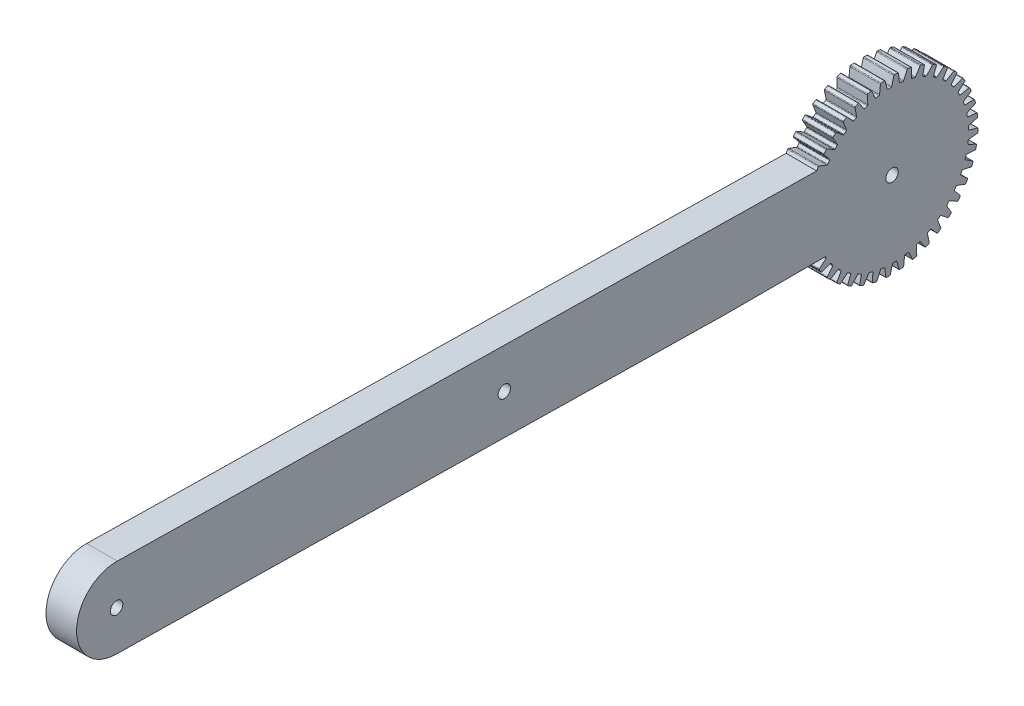
from build123d import *

# Parameters (mm, degrees)
SKETCH2_R           = 1.625
BOSS_EXTRUDE1_DEPTH = 8
CUT_EXTRUDE1_DEPTH  = 279.604808249


with BuildPart() as part:
    # Sketch2 → Boss-Extrude1 (new body)
    with BuildSketch(Plane(origin=(0, 0, 0), x_dir=(0, 0, -1), z_dir=(1, 0, 0))):
        with BuildLine():
            Line((-43.23933315, 11.215547635), (-202.79379149, 13.913019855))
            ThreePointArc((-202.79379149, 13.913019855), (-213.452530796, 3.608688081), (-203.148199023, -7.050051225))
            Line((-203.148199023, -7.050051225), (-43.593740683, -9.747523445))
            ThreePointArc((-43.593740683, -9.747523445), (44.663836211, -0.755099285), (-43.23933315, 11.215547635))
        make_face()
        Circle(SKETCH2_R, mode=Mode.SUBTRACT)
        with Locations((-101.485497628, 1.715742158)):
            Circle(SKETCH2_R, mode=Mode.SUBTRACT)
        with Locations((-202.970995256, 3.431484315)):
            Circle(SKETCH2_R, mode=Mode.SUBTRACT)
    extrude(amount=BOSS_EXTRUDE1_DEPTH)

    # Sketch3 → Cut-Extrude1 (cut, through all)
    with BuildSketch(Plane(origin=(42.059935628, -65.895972954, -38.789342463), x_dir=(0, 0, -1), z_dir=(1, 0, 0))):
        with BuildLine():
            Line((-102.949192545, 77.465208689), (-58.517985993, 76.714042306))
            ThreePointArc((-58.517985993, 76.714042306), (-58.31883232, 77.069559037), (-58.113272808, 77.421410735))
            add(Edge.make_bspline(
                [(-57.869092819, 77.506556913), (-57.913153745, 77.523470318), (-57.962778173, 77.523903324), (-58.050621186, 77.493152516), (-58.089100649, 77.461938576), (-58.113272808, 77.421410735)],
                knots=[0, 0, 0, 0, 0.5, 0.5, 1, 1, 1, 1], degree=3))
            Line((-57.869092819, 77.506556913), (-55.827954437, 76.723037297))
            add(Edge.make_bspline(
                [(-55.827954437, 76.723037297), (-55.684412293, 76.66793663), (-55.593547591, 76.793001162)],
                knots=[0.26035441, 0.26035441, 0.26035441, 1.570796327, 1.570796327, 1.570796327], degree=2, weights=[1, 0.79291331, 1]))
            Line((-55.593547591, 76.793001162), (-55.158102479, 77.392339943))
            add(Edge.make_bspline(
                [(-55.158102479, 77.392339943), (-55.067237778, 77.517404475), (-55.163998588, 77.636894124)],
                knots=[1.570796327, 1.570796327, 1.570796327, 2.881238244, 2.881238244, 2.881238244], degree=2, weights=[1, 0.79291331, 1]))
            Line((-55.163998588, 77.636894124), (-56.593034605, 79.401606638))
            add(Edge.make_bspline(
                [(-56.595360501, 79.650816525), (-56.623008193, 79.615025838), (-56.637870062, 79.570981421), (-56.637143942, 79.480671547), (-56.621500493, 79.436759083), (-56.593034605, 79.401606638)],
                knots=[0, 0, 0, 0, 0.5, 0.5, 1, 1, 1, 1], degree=3))
            ThreePointArc((-56.595360501, 79.650816525), (-56.336898995, 79.979057125), (-56.072387465, 80.302442177))
            add(Edge.make_bspline(
                [(-55.817893941, 80.348341897), (-55.85876649, 80.371939675), (-55.907712222, 80.380130228), (-55.999283134, 80.363500184), (-56.04217301, 80.338689629), (-56.072387465, 80.302442177)],
                knots=[0, 0, 0, 0, 0.5, 0.5, 1, 1, 1, 1], degree=3))
            Line((-55.817893941, 80.348341897), (-53.924454831, 79.255164318))
            add(Edge.make_bspline(
                [(-53.924454831, 79.255164318), (-53.791299572, 79.178287093), (-53.681989163, 79.287597502)],
                knots=[0.26035441, 0.26035441, 0.26035441, 1.570796327, 1.570796327, 1.570796327], degree=2, weights=[1, 0.79291331, 1]))
            Line((-53.681989163, 79.287597502), (-53.158147861, 79.811438804))
            add(Edge.make_bspline(
                [(-53.158147861, 79.811438804), (-53.048837452, 79.920749213), (-53.125714676, 80.053904472)],
                knots=[1.570796327, 1.570796327, 1.570796327, 2.881238244, 2.881238244, 2.881238244], degree=2, weights=[1, 0.79291331, 1]))
            Line((-53.125714676, 80.053904472), (-54.261095031, 82.020440932))
            add(Edge.make_bspline(
                [(-54.224407276, 82.266946482), (-54.257313476, 82.235921489), (-54.278882435, 82.194744241), (-54.292292832, 82.105432641), (-54.283711403, 82.059613638), (-54.261095031, 82.020440932)],
                knots=[0, 0, 0, 0, 0.5, 0.5, 1, 1, 1, 1], degree=3))
            ThreePointArc((-54.224407276, 82.266946482), (-53.917779718, 82.550713608), (-53.605936196, 82.828738534))
            add(Edge.make_bspline(
                [(-53.347395611, 82.834261594), (-53.384073377, 82.863962664), (-53.431135203, 82.87970908), (-53.524179072, 82.877608962), (-53.570423444, 82.85981308), (-53.605936196, 82.828738534)],
                knots=[0, 0, 0, 0, 0.5, 0.5, 1, 1, 1, 1], degree=3))
            Line((-53.347395611, 82.834261594), (-51.648278528, 81.45834371))
            add(Edge.make_bspline(
                [(-51.648278528, 81.45834371), (-51.528788879, 81.3615829), (-51.403724347, 81.452447601)],
                knots=[0.26035441, 0.26035441, 0.26035441, 1.570796327, 1.570796327, 1.570796327], degree=2, weights=[1, 0.79291331, 1]))
            Line((-51.403724347, 81.452447601), (-50.804385567, 81.887892714))
            add(Edge.make_bspline(
                [(-50.804385567, 81.887892714), (-50.679321035, 81.978757415), (-50.734421702, 82.122299559)],
                knots=[1.570796327, 1.570796327, 1.570796327, 2.881238244, 2.881238244, 2.881238244], degree=2, weights=[1, 0.79291331, 1]))
            Line((-50.734421702, 82.122299559), (-51.548189561, 84.24223731))
            add(Edge.make_bspline(
                [(-51.473391529, 84.479968738), (-51.510745977, 84.454473379), (-51.538490928, 84.417177219), (-51.565707632, 84.331063042), (-51.564399527, 84.284465715), (-51.548189561, 84.24223731)],
                knots=[0, 0, 0, 0, 0.5, 0.5, 1, 1, 1, 1], degree=3))
            ThreePointArc((-51.473391529, 84.479968738), (-51.126148106, 84.712275102), (-50.774651215, 84.938094005))
            add(Edge.make_bspline(
                [(-50.518429697, 84.90310441), (-50.550009575, 84.938177417), (-50.594028674, 84.961091957), (-50.686254455, 84.973573116), (-50.734714621, 84.963230512), (-50.774651215, 84.938094005)],
                knots=[0, 0, 0, 0, 0.5, 0.5, 1, 1, 1, 1], degree=3))
            Line((-50.518429697, 84.90310441), (-49.055472543, 83.278325886))
            add(Edge.make_bspline(
                [(-49.055472543, 83.278325886), (-48.952590735, 83.164064063), (-48.814851584, 83.234245666)],
                knots=[0.26035441, 0.26035441, 0.26035441, 1.570796327, 1.570796327, 1.570796327], degree=2, weights=[1, 0.79291331, 1]))
            Line((-48.814851584, 83.234245666), (-48.154773036, 83.570572485))
            add(Edge.make_bspline(
                [(-48.154773036, 83.570572485), (-48.017033885, 83.640754088), (-48.049001232, 83.791148633)],
                knots=[1.570796327, 1.570796327, 1.570796327, 2.881238244, 2.881238244, 2.881238244], degree=2, weights=[1, 0.79291331, 1]))
            Line((-48.049001232, 83.791148633), (-48.521118931, 86.012287772))
            add(Edge.make_bspline(
                [(-48.410052398, 86.235391342), (-48.450935304, 86.216053396), (-48.484173073, 86.18355668), (-48.52452592, 86.102760342), (-48.530523347, 86.056532073), (-48.521118931, 86.012287772)],
                knots=[0, 0, 0, 0, 0.5, 0.5, 1, 1, 1, 1], degree=3))
            ThreePointArc((-48.410052398, 86.235391342), (-48.030743397, 86.41051679), (-47.648248156, 86.57856926))
            add(Edge.make_bspline(
                [(-47.400654728, 86.503928568), (-47.426359143, 86.543509895), (-47.466251629, 86.573028322), (-47.555388572, 86.599783103), (-47.604871092, 86.597148809), (-47.648248156, 86.57856926)],
                knots=[0, 0, 0, 0, 0.5, 0.5, 1, 1, 1, 1], degree=3))
            Line((-47.400654728, 86.503928568), (-46.209880364, 84.670296844))
            add(Edge.make_bspline(
                [(-46.209880364, 84.670296844), (-46.126139689, 84.541347513), (-45.979117514, 84.589117913)],
                knots=[0.26035441, 0.26035441, 0.26035441, 1.570796327, 1.570796327, 1.570796327], degree=2, weights=[1, 0.79291331, 1]))
            Line((-45.979117514, 84.589117913), (-45.274552522, 84.818044957))
            add(Edge.make_bspline(
                [(-45.274552522, 84.818044957), (-45.127530347, 84.865815357), (-45.135577233, 85.019359091)],
                knots=[1.570796327, 1.570796327, 1.570796327, 2.881238244, 2.881238244, 2.881238244], degree=2, weights=[1, 0.79291331, 1]))
            Line((-45.135577233, 85.019359091), (-45.254419666, 87.287007801))
            add(Edge.make_bspline(
                [(-45.10981946, 87.489989962), (-45.15322415, 87.477285594), (-45.191136313, 87.450388499), (-45.243631682, 87.376899474), (-45.256786965, 87.332178556), (-45.254419666, 87.287007801)],
                knots=[0, 0, 0, 0, 0.5, 0.5, 1, 1, 1, 1], degree=3))
            ThreePointArc((-45.10981946, 87.489989962), (-44.707784725, 87.603622325), (-44.303709438, 87.709770351))
            add(Edge.make_bspline(
                [(-44.070840673, 87.597316465), (-44.090036721, 87.640431494), (-44.124820335, 87.675826975), (-44.208673855, 87.716196355), (-44.25795998, 87.721335476), (-44.303709438, 87.709770351)],
                knots=[0, 0, 0, 0, 0.5, 0.5, 1, 1, 1, 1], degree=3))
            Line((-44.070840673, 87.597316465), (-43.181569915, 85.59998164))
            add(Edge.make_bspline(
                [(-43.181569915, 85.59998164), (-43.119032346, 85.459519961), (-42.966347321, 85.483702893)],
                knots=[0.26035441, 0.26035441, 0.26035441, 1.570796327, 1.570796327, 1.570796327], degree=2, weights=[1, 0.79291331, 1]))
            Line((-42.966347321, 85.483702893), (-42.234644614, 85.599593217))
            add(Edge.make_bspline(
                [(-42.234644614, 85.599593217), (-42.081959589, 85.623776149), (-42.065887872, 85.776688316)],
                knots=[1.570796327, 1.570796327, 1.570796327, 2.881238244, 2.881238244, 2.881238244], degree=2, weights=[1, 0.79291331, 1]))
            Line((-42.065887872, 85.776688316), (-41.828528745, 88.03500956))
            add(Edge.make_bspline(
                [(-41.653955401, 88.212872217), (-41.698813109, 88.20711425), (-41.740466143, 88.186479073), (-41.803811423, 88.122106904), (-41.823800636, 88.079994514), (-41.828528745, 88.03500956)],
                knots=[0, 0, 0, 0, 0.5, 0.5, 1, 1, 1, 1], degree=3))
            ThreePointArc((-41.653955401, 88.212872217), (-41.239094363, 88.262213488), (-40.823388704, 88.303843355))
            add(Edge.make_bspline(
                [(-40.610978603, 88.156345262), (-40.623193633, 88.201932374), (-40.652011917, 88.242333383), (-40.728517584, 88.295323232), (-40.776393336, 88.3081093), (-40.823388704, 88.303843355)],
                knots=[0, 0, 0, 0, 0.5, 0.5, 1, 1, 1, 1], degree=3))
            Line((-40.610978603, 88.156345262), (-40.045108248, 86.044488347))
            add(Edge.make_bspline(
                [(-40.045108248, 86.044488347), (-40.005313669, 85.895972954), (-39.850725406, 85.895972954)],
                knots=[0.26035441, 0.26035441, 0.26035441, 1.570796327, 1.570796327, 1.570796327], degree=2, weights=[1, 0.79291331, 1]))
            Line((-39.850725406, 85.895972954), (-39.109901932, 85.895972954))
            add(Edge.make_bspline(
                [(-39.109901932, 85.895972954), (-38.955313669, 85.895972954), (-38.915519089, 86.044488347)],
                knots=[1.570796327, 1.570796327, 1.570796327, 2.881238244, 2.881238244, 2.881238244], degree=2, weights=[1, 0.79291331, 1]))
            Line((-38.915519089, 86.044488347), (-38.327802971, 88.237874762))
            add(Edge.make_bspline(
                [(-38.127555064, 88.386238347), (-38.172761244, 88.387568562), (-38.217129513, 88.373703407), (-38.289764933, 88.320033152), (-38.316095875, 88.281566237), (-38.327802971, 88.237874762)],
                knots=[0, 0, 0, 0, 0.5, 0.5, 1, 1, 1, 1], degree=3))
            ThreePointArc((-38.127555064, 88.386238347), (-37.710082979, 88.370073581), (-37.292983, 88.346160222))
            add(Edge.make_bspline(
                [(-37.106261806, 88.167249815), (-37.111195053, 88.214186525), (-37.133338425, 88.258598302), (-37.200612736, 88.322903879), (-37.245898884, 88.343021951), (-37.292983, 88.346160222)],
                knots=[0, 0, 0, 0, 0.5, 0.5, 1, 1, 1, 1], degree=3))
            Line((-37.106261806, 88.167249815), (-36.877725461, 85.992871737))
            add(Edge.make_bspline(
                [(-36.877725461, 85.992871737), (-36.861653745, 85.839959571), (-36.70896872, 85.815776639)],
                knots=[0.26035441, 0.26035441, 0.26035441, 1.570796327, 1.570796327, 1.570796327], degree=2, weights=[1, 0.79291331, 1]))
            Line((-36.70896872, 85.815776639), (-35.977266012, 85.699886315))
            add(Edge.make_bspline(
                [(-35.977266012, 85.699886315), (-35.824580987, 85.675703383), (-35.762043418, 85.816165061)],
                knots=[1.570796327, 1.570796327, 1.570796327, 2.881238244, 2.881238244, 2.881238244], degree=2, weights=[1, 0.79291331, 1]))
            Line((-35.762043418, 85.816165061), (-34.83844183, 87.890608192))
            add(Edge.make_bspline(
                [(-34.61745013, 88.005819502), (-34.661891655, 88.014205144), (-34.707882665, 88.007451419), (-34.788019701, 87.965804617), (-34.820044016, 87.931930361), (-34.83844183, 87.890608192)],
                knots=[0, 0, 0, 0, 0.5, 0.5, 1, 1, 1, 1], degree=3))
            ThreePointArc((-34.61745013, 88.005819502), (-34.207646546, 87.924546728), (-33.799422633, 87.835678971))
            add(Edge.make_bspline(
                [(-33.64298804, 87.629761617), (-33.64051803, 87.676892212), (-33.655441246, 87.724221243), (-33.711827949, 87.798259315), (-33.753409111, 87.825213754), (-33.799422633, 87.835678971)],
                knots=[0, 0, 0, 0, 0.5, 0.5, 1, 1, 1, 1], degree=3))
            Line((-33.64298804, 87.629761617), (-33.757413028, 85.446402781))
            add(Edge.make_bspline(
                [(-33.757413028, 85.446402781), (-33.765459914, 85.292859047), (-33.618437739, 85.245088647)],
                knots=[0.26035441, 0.26035441, 0.26035441, 1.570796327, 1.570796327, 1.570796327], degree=2, weights=[1, 0.79291331, 1]))
            Line((-33.618437739, 85.245088647), (-32.913872747, 85.016161604))
            add(Edge.make_bspline(
                [(-32.913872747, 85.016161604), (-32.766850572, 84.968391203), (-32.683109897, 85.097340534)],
                knots=[1.570796327, 1.570796327, 1.570796327, 2.881238244, 2.881238244, 2.881238244], degree=2, weights=[1, 0.79291331, 1]))
            Line((-32.683109897, 85.097340534), (-31.446364976, 87.001760708))
            add(Edge.make_bspline(
                [(-31.210071031, 87.080982856), (-31.252653604, 87.096217443), (-31.299134903, 87.096741447), (-31.384800314, 87.06814358), (-31.421729458, 87.039696079), (-31.446364976, 87.001760708)],
                knots=[0, 0, 0, 0, 0.5, 0.5, 1, 1, 1, 1], degree=3))
            ThreePointArc((-31.210071031, 87.080982856), (-30.818026672, 86.936603281), (-30.428730653, 86.784969343))
            add(Edge.make_bspline(
                [(-30.3064346, 86.557115412), (-30.296622142, 86.603279401), (-30.303957711, 86.652360325), (-30.348068539, 86.734308127), (-30.384920713, 86.767434853), (-30.428730653, 86.784969343)],
                knots=[0, 0, 0, 0, 0.5, 0.5, 1, 1, 1, 1], degree=3))
            Line((-30.3064346, 86.557115412), (-30.761003398, 84.418537359))
            add(Edge.make_bspline(
                [(-30.761003398, 84.418537359), (-30.792970746, 84.268142813), (-30.655231595, 84.19796121)],
                knots=[0.26035441, 0.26035441, 0.26035441, 1.570796327, 1.570796327, 1.570796327], degree=2, weights=[1, 0.79291331, 1]))
            Line((-30.655231595, 84.19796121), (-29.995153046, 83.861634391))
            add(Edge.make_bspline(
                [(-29.995153046, 83.861634391), (-29.857413895, 83.791452788), (-29.754532088, 83.905714612)],
                knots=[1.570796327, 1.570796327, 1.570796327, 2.881238244, 2.881238244, 2.881238244], degree=2, weights=[1, 0.79291331, 1]))
            Line((-29.754532088, 83.905714612), (-28.235096597, 85.593218682))
            add(Edge.make_bspline(
                [(-27.989318748, 85.634500958), (-28.028993845, 85.656209364), (-28.07482091, 85.663998194), (-28.16390533, 85.649153437), (-28.204829984, 85.626833162), (-28.235096597, 85.593218682)],
                knots=[0, 0, 0, 0, 0.5, 0.5, 1, 1, 1, 1], degree=3))
            ThreePointArc((-27.989318748, 85.634500958), (-27.624687047, 85.430569685), (-27.263904682, 85.219903299))
            add(Edge.make_bspline(
                [(-27.178758505, 84.97572331), (-27.161845192, 85.019783997), (-27.161412443, 85.069408281), (-27.192161255, 85.157248349), (-27.223377059, 85.19573127), (-27.263904682, 85.219903299)],
                knots=[0, 0, 0, 0, 0.5, 0.5, 1, 1, 1, 1], degree=3))
            Line((-27.178758505, 84.97572331), (-27.962278121, 82.934584927))
            add(Edge.make_bspline(
                [(-27.962278121, 82.934584927), (-28.017378787, 82.791042783), (-27.892314255, 82.700178082)],
                knots=[0.26035441, 0.26035441, 0.26035441, 1.570796327, 1.570796327, 1.570796327], degree=2, weights=[1, 0.79291331, 1]))
            Line((-27.892314255, 82.700178082), (-27.292975475, 82.26473297))
            add(Edge.make_bspline(
                [(-27.292975475, 82.26473297), (-27.167910943, 82.173868268), (-27.048421294, 82.270629078)],
                knots=[1.570796327, 1.570796327, 1.570796327, 2.881238244, 2.881238244, 2.881238244], degree=2, weights=[1, 0.79291331, 1]))
            Line((-27.048421294, 82.270629078), (-25.28370878, 83.699665096))
            add(Edge.make_bspline(
                [(-25.034498893, 83.701990992), (-25.07028958, 83.729638684), (-25.114333997, 83.744500552), (-25.204643871, 83.743774433), (-25.248556335, 83.728130984), (-25.28370878, 83.699665096)],
                knots=[0, 0, 0, 0, 0.5, 0.5, 1, 1, 1, 1], degree=3))
            ThreePointArc((-25.034498893, 83.701990992), (-24.706258293, 83.443529486), (-24.382873241, 83.179017956))
            add(Edge.make_bspline(
                [(-24.33697352, 82.924524432), (-24.313375788, 82.965396902), (-24.305185332, 83.014342599), (-24.321814842, 83.105912371), (-24.346625858, 83.148803558), (-24.382873241, 83.179017956)],
                knots=[0, 0, 0, 0, 0.5, 0.5, 1, 1, 1, 1], degree=3))
            Line((-24.33697352, 82.924524432), (-25.4301511, 81.031085322))
            add(Edge.make_bspline(
                [(-25.4301511, 81.031085322), (-25.507028325, 80.897930063), (-25.397717916, 80.788619654)],
                knots=[0.26035441, 0.26035441, 0.26035441, 1.570796327, 1.570796327, 1.570796327], degree=2, weights=[1, 0.79291331, 1]))
            Line((-25.397717916, 80.788619654), (-24.873876614, 80.264778352))
            add(Edge.make_bspline(
                [(-24.873876614, 80.264778352), (-24.764566204, 80.155467943), (-24.631410946, 80.232345167)],
                knots=[1.570796327, 1.570796327, 1.570796327, 2.881238244, 2.881238244, 2.881238244], degree=2, weights=[1, 0.79291331, 1]))
            Line((-24.631410946, 80.232345167), (-22.664874486, 81.367725522))
            add(Edge.make_bspline(
                [(-22.418368936, 81.331037767), (-22.449393928, 81.363943967), (-22.490571177, 81.385512926), (-22.579882777, 81.398923323), (-22.62570178, 81.390341894), (-22.664874486, 81.367725522)],
                knots=[0, 0, 0, 0, 0.5, 0.5, 1, 1, 1, 1], degree=3))
            ThreePointArc((-22.418368936, 81.331037767), (-22.13460181, 81.024410208), (-21.856576884, 80.712566687))
            add(Edge.make_bspline(
                [(-21.851053824, 80.454026102), (-21.821352701, 80.490703933), (-21.805606191, 80.537765778), (-21.807706632, 80.630810765), (-21.825502283, 80.677053873), (-21.856576884, 80.712566687)],
                knots=[0, 0, 0, 0, 0.5, 0.5, 1, 1, 1, 1], degree=3))
            Line((-21.851053824, 80.454026102), (-23.226971708, 78.754909019))
            add(Edge.make_bspline(
                [(-23.226971708, 78.754909019), (-23.323732518, 78.63541937), (-23.232867816, 78.510354838)],
                knots=[0.26035441, 0.26035441, 0.26035441, 1.570796327, 1.570796327, 1.570796327], degree=2, weights=[1, 0.79291331, 1]))
            Line((-23.232867816, 78.510354838), (-22.797422704, 77.911016058))
            add(Edge.make_bspline(
                [(-22.797422704, 77.911016058), (-22.706558003, 77.785951526), (-22.563015859, 77.841052192)],
                knots=[1.570796327, 1.570796327, 1.570796327, 2.881238244, 2.881238244, 2.881238244], degree=2, weights=[1, 0.79291331, 1]))
            Line((-22.563015859, 77.841052192), (-20.443078107, 78.654820051))
            add(Edge.make_bspline(
                [(-20.205346679, 78.58002202), (-20.230842039, 78.617376468), (-20.268138199, 78.645121418), (-20.354252376, 78.672338123), (-20.400849703, 78.671030017), (-20.443078107, 78.654820051)],
                knots=[0, 0, 0, 0, 0.5, 0.5, 1, 1, 1, 1], degree=3))
            ThreePointArc((-20.205346679, 78.58002202), (-19.973040315, 78.232778597), (-19.747221412, 77.881281706))
            add(Edge.make_bspline(
                [(-19.782211008, 77.625060187), (-19.747137815, 77.656640233), (-19.724222988, 77.700659342), (-19.71174226, 77.792888569), (-19.722084774, 77.841344903), (-19.747221412, 77.881281706)],
                knots=[0, 0, 0, 0, 0.5, 0.5, 1, 1, 1, 1], degree=3))
            Line((-19.782211008, 77.625060187), (-21.406989532, 76.162103034))
            add(Edge.make_bspline(
                [(-21.406989532, 76.162103034), (-21.521251355, 76.059221226), (-21.451069752, 75.921482075)],
                knots=[0.26035441, 0.26035441, 0.26035441, 1.570796327, 1.570796327, 1.570796327], degree=2, weights=[1, 0.79291331, 1]))
            Line((-21.451069752, 75.921482075), (-21.114742933, 75.261403527))
            add(Edge.make_bspline(
                [(-21.114742933, 75.261403527), (-21.04456133, 75.123664376), (-20.894166785, 75.155631723)],
                knots=[1.570796327, 1.570796327, 1.570796327, 2.881238244, 2.881238244, 2.881238244], degree=2, weights=[1, 0.79291331, 1]))
            Line((-20.894166785, 75.155631723), (-18.673027645, 75.627749422))
            add(Edge.make_bspline(
                [(-18.449924076, 75.516682889), (-18.469262022, 75.557565795), (-18.501758738, 75.590803564), (-18.582555076, 75.631156411), (-18.628783345, 75.637153838), (-18.673027645, 75.627749422)],
                knots=[0, 0, 0, 0, 0.5, 0.5, 1, 1, 1, 1], degree=3))
            ThreePointArc((-18.449924076, 75.516682889), (-18.274798628, 75.137373887), (-18.106746158, 74.754878647))
            add(Edge.make_bspline(
                [(-18.18138685, 74.507285219), (-18.141805194, 74.532989847), (-18.112286321, 74.57288228), (-18.085531362, 74.66202466), (-18.088166456, 74.711501226), (-18.106746158, 74.754878647)],
                knots=[0, 0, 0, 0, 0.5, 0.5, 1, 1, 1, 1], degree=3))
            Line((-18.18138685, 74.507285219), (-20.015018574, 73.316510855))
            add(Edge.make_bspline(
                [(-20.015018574, 73.316510855), (-20.143967905, 73.23277018), (-20.096197504, 73.085748005)],
                knots=[0.26035441, 0.26035441, 0.26035441, 1.570796327, 1.570796327, 1.570796327], degree=2, weights=[1, 0.79291331, 1]))
            Line((-20.096197504, 73.085748005), (-19.867270461, 72.381183013))
            add(Edge.make_bspline(
                [(-19.867270461, 72.381183013), (-19.819500061, 72.234160838), (-19.665956327, 72.242207724)],
                knots=[1.570796327, 1.570796327, 1.570796327, 2.881238244, 2.881238244, 2.881238244], degree=2, weights=[1, 0.79291331, 1]))
            Line((-19.665956327, 72.242207724), (-17.398307616, 72.361050157))
            add(Edge.make_bspline(
                [(-17.195325455, 72.21644995), (-17.208029824, 72.259854641), (-17.234926919, 72.297766804), (-17.308415944, 72.350262173), (-17.353136862, 72.363417456), (-17.398307616, 72.361050157)],
                knots=[0, 0, 0, 0, 0.5, 0.5, 1, 1, 1, 1], degree=3))
            ThreePointArc((-17.195325455, 72.21644995), (-17.081693093, 71.814415216), (-16.975545067, 71.410339929))
            add(Edge.make_bspline(
                [(-17.087998953, 71.177471164), (-17.044883472, 71.196667413), (-17.009487444, 71.231450872), (-16.969116767, 71.315311144), (-16.963979821, 71.364589996), (-16.975545067, 71.410339929)],
                knots=[0, 0, 0, 0, 0.5, 0.5, 1, 1, 1, 1], degree=3))
            Line((-17.087998953, 71.177471164), (-19.085333778, 70.288200405))
            add(Edge.make_bspline(
                [(-19.085333778, 70.288200405), (-19.225795457, 70.225662837), (-19.201612524, 70.072977812)],
                knots=[0.26035441, 0.26035441, 0.26035441, 1.570796327, 1.570796327, 1.570796327], degree=2, weights=[1, 0.79291331, 1]))
            Line((-19.201612524, 70.072977812), (-19.085722201, 69.341275104))
            add(Edge.make_bspline(
                [(-19.085722201, 69.341275104), (-19.061539268, 69.188590079), (-18.908627102, 69.172518363)],
                knots=[1.570796327, 1.570796327, 1.570796327, 2.881238244, 2.881238244, 2.881238244], degree=2, weights=[1, 0.79291331, 1]))
            Line((-18.908627102, 69.172518363), (-16.650305858, 68.935159236))
            add(Edge.make_bspline(
                [(-16.4724432, 68.760585892), (-16.478201167, 68.8054436), (-16.498836345, 68.847096634), (-16.563208514, 68.910441914), (-16.605320903, 68.930431126), (-16.650305858, 68.935159236)],
                knots=[0, 0, 0, 0, 0.5, 0.5, 1, 1, 1, 1], degree=3))
            ThreePointArc((-16.4724432, 68.760585892), (-16.423101929, 68.345724854), (-16.381472063, 67.930019194))
            add(Edge.make_bspline(
                [(-16.528970156, 67.717609094), (-16.483382513, 67.729824266), (-16.44298093, 67.758642286), (-16.389988485, 67.835155134), (-16.377206068, 67.883023286), (-16.381472063, 67.930019194)],
                knots=[0, 0, 0, 0, 0.5, 0.5, 1, 1, 1, 1], degree=3))
            Line((-16.528970156, 67.717609094), (-18.64082707, 67.151738739))
            add(Edge.make_bspline(
                [(-18.64082707, 67.151738739), (-18.789342463, 67.111944159), (-18.789342463, 66.957355896)],
                knots=[0.26035441, 0.26035441, 0.26035441, 1.570796327, 1.570796327, 1.570796327], degree=2, weights=[1, 0.79291331, 1]))
            Line((-18.789342463, 66.957355896), (-18.789342463, 66.216532422))
            add(Edge.make_bspline(
                [(-18.789342463, 66.216532422), (-18.789342463, 66.061944159), (-18.64082707, 66.02214958)],
                knots=[1.570796327, 1.570796327, 1.570796327, 2.881238244, 2.881238244, 2.881238244], degree=2, weights=[1, 0.79291331, 1]))
            Line((-18.64082707, 66.02214958), (-16.447440656, 65.434433461))
            add(Edge.make_bspline(
                [(-16.299077071, 65.234185555), (-16.297746856, 65.279391735), (-16.31161201, 65.323760004), (-16.365282266, 65.396395424), (-16.40374918, 65.422726366), (-16.447440656, 65.434433461)],
                knots=[0, 0, 0, 0, 0.5, 0.5, 1, 1, 1, 1], degree=3))
            ThreePointArc((-16.299077071, 65.234185555), (-16.315241837, 64.81671347), (-16.339155196, 64.399613491))
            add(Edge.make_bspline(
                [(-16.518065603, 64.212892297), (-16.471128345, 64.217825601), (-16.426716041, 64.239968623), (-16.36240677, 64.307249633), (-16.342293503, 64.352528831), (-16.339155196, 64.399613491)],
                knots=[0, 0, 0, 0, 0.5, 0.5, 1, 1, 1, 1], degree=3))
            Line((-16.518065603, 64.212892297), (-18.692443681, 63.984355952))
            add(Edge.make_bspline(
                [(-18.692443681, 63.984355952), (-18.845355847, 63.968284235), (-18.869538779, 63.81559921)],
                knots=[0.26035441, 0.26035441, 0.26035441, 1.570796327, 1.570796327, 1.570796327], degree=2, weights=[1, 0.79291331, 1]))
            Line((-18.869538779, 63.81559921), (-18.985429103, 63.083896503))
            add(Edge.make_bspline(
                [(-18.985429103, 63.083896503), (-19.009612035, 62.931211478), (-18.869150356, 62.868673909)],
                knots=[1.570796327, 1.570796327, 1.570796327, 2.881238244, 2.881238244, 2.881238244], degree=2, weights=[1, 0.79291331, 1]))
            Line((-18.869150356, 62.868673909), (-16.794707225, 61.945072321))
            add(Edge.make_bspline(
                [(-16.679495916, 61.724080621), (-16.671110274, 61.768522146), (-16.677863999, 61.814513156), (-16.719510801, 61.894650192), (-16.753385057, 61.926674507), (-16.794707225, 61.945072321)],
                knots=[0, 0, 0, 0, 0.5, 0.5, 1, 1, 1, 1], degree=3))
            ThreePointArc((-16.679495916, 61.724080621), (-16.760768689, 61.314277037), (-16.849636447, 60.906053124))
            add(Edge.make_bspline(
                [(-17.055553801, 60.749618531), (-17.008422709, 60.747148495), (-16.961093257, 60.762071322), (-16.887050938, 60.818463486), (-16.860101773, 60.860039122), (-16.849636447, 60.906053124)],
                knots=[0, 0, 0, 0, 0.5, 0.5, 1, 1, 1, 1], degree=3))
            Line((-17.055553801, 60.749618531), (-19.238912637, 60.864043519))
            add(Edge.make_bspline(
                [(-19.238912637, 60.864043519), (-19.392456371, 60.872090405), (-19.440226771, 60.72506823)],
                knots=[0.26035441, 0.26035441, 0.26035441, 1.570796327, 1.570796327, 1.570796327], degree=2, weights=[1, 0.79291331, 1]))
            Line((-19.440226771, 60.72506823), (-19.669153814, 60.020503238))
            add(Edge.make_bspline(
                [(-19.669153814, 60.020503238), (-19.716924215, 59.873481063), (-19.587974884, 59.789740388)],
                knots=[1.570796327, 1.570796327, 1.570796327, 2.881238244, 2.881238244, 2.881238244], degree=2, weights=[1, 0.79291331, 1]))
            Line((-19.587974884, 59.789740388), (-17.68355471, 58.552995467))
            add(Edge.make_bspline(
                [(-17.604332561, 58.316701522), (-17.589097974, 58.359284095), (-17.588573971, 58.405765394), (-17.617171837, 58.491430805), (-17.645619339, 58.528359949), (-17.68355471, 58.552995467)],
                knots=[0, 0, 0, 0, 0.5, 0.5, 1, 1, 1, 1], degree=3))
            ThreePointArc((-17.604332561, 58.316701522), (-17.748712137, 57.924657162), (-17.900346074, 57.535361143))
            add(Edge.make_bspline(
                [(-18.128200005, 57.413065091), (-18.082035629, 57.40325255), (-18.032954424, 57.410587761), (-17.951002602, 57.454702355), (-17.91788071, 57.491550839), (-17.900346074, 57.535361143)],
                knots=[0, 0, 0, 0, 0.5, 0.5, 1, 1, 1, 1], degree=3))
            Line((-18.128200005, 57.413065091), (-20.266778059, 57.867633889))
            add(Edge.make_bspline(
                [(-20.266778059, 57.867633889), (-20.417172605, 57.899601236), (-20.487354207, 57.761862086)],
                knots=[0.26035441, 0.26035441, 0.26035441, 1.570796327, 1.570796327, 1.570796327], degree=2, weights=[1, 0.79291331, 1]))
            Line((-20.487354207, 57.761862086), (-20.823681027, 57.101783537))
            add(Edge.make_bspline(
                [(-20.823681027, 57.101783537), (-20.893862629, 56.964044386), (-20.779600806, 56.861162578)],
                knots=[1.570796327, 1.570796327, 1.570796327, 2.881238244, 2.881238244, 2.881238244], degree=2, weights=[1, 0.79291331, 1]))
            Line((-20.779600806, 56.861162578), (-19.988052752, 56.14844951))
            Line((-19.988052752, 56.14844951), (-19.092096735, 55.341727088))
            add(Edge.make_bspline(
                [(-19.05081446, 55.095949239), (-19.029106054, 55.135624335), (-19.021317224, 55.181451401), (-19.036161981, 55.27053582), (-19.058482256, 55.311460475), (-19.092096735, 55.341727088)],
                knots=[0, 0, 0, 0, 0.5, 0.5, 1, 1, 1, 1], degree=3))
            ThreePointArc((-19.05081446, 55.095949239), (-19.254745733, 54.731317538), (-19.465412119, 54.370535173))
            add(Edge.make_bspline(
                [(-19.709592108, 54.285388996), (-19.665531182, 54.268475591), (-19.615906754, 54.268042585), (-19.528063741, 54.298793393), (-19.489584278, 54.330007332), (-19.465412119, 54.370535173)],
                knots=[0, 0, 0, 0, 0.5, 0.5, 1, 1, 1, 1], degree=3))
            Line((-19.709592108, 54.285388996), (-21.75073049, 55.068908611))
            add(Edge.make_bspline(
                [(-21.75073049, 55.068908611), (-21.894272634, 55.124009278), (-21.985137336, 54.998944746)],
                knots=[0.26035441, 0.26035441, 0.26035441, 1.570796327, 1.570796327, 1.570796327], degree=2, weights=[1, 0.79291331, 1]))
            Line((-21.985137336, 54.998944746), (-22.420582448, 54.399605966))
            add(Edge.make_bspline(
                [(-22.420582448, 54.399605966), (-22.511447149, 54.274541434), (-22.414686339, 54.155051785)],
                knots=[1.570796327, 1.570796327, 1.570796327, 2.881238244, 2.881238244, 2.881238244], degree=2, weights=[1, 0.79291331, 1]))
            Line((-22.414686339, 54.155051785), (-20.985650322, 52.39033927))
            add(Edge.make_bspline(
                [(-20.983324426, 52.141129384), (-20.955676734, 52.176920071), (-20.940814865, 52.220964488), (-20.941540985, 52.311274362), (-20.957184434, 52.355186826), (-20.985650322, 52.39033927)],
                knots=[0, 0, 0, 0, 0.5, 0.5, 1, 1, 1, 1], degree=3))
            ThreePointArc((-20.983324426, 52.141129384), (-21.241785932, 51.812888784), (-21.506297462, 51.489503732))
            add(Edge.make_bspline(
                [(-21.760790986, 51.443604011), (-21.719918437, 51.420006234), (-21.670972705, 51.41181568), (-21.579401793, 51.428445724), (-21.536511917, 51.45325628), (-21.506297462, 51.489503732)],
                knots=[0, 0, 0, 0, 0.5, 0.5, 1, 1, 1, 1], degree=3))
            Line((-21.760790986, 51.443604011), (-23.654230096, 52.536781591))
            add(Edge.make_bspline(
                [(-23.654230096, 52.536781591), (-23.787385355, 52.613658815), (-23.896695764, 52.504348406)],
                knots=[0.26035441, 0.26035441, 0.26035441, 1.570796327, 1.570796327, 1.570796327], degree=2, weights=[1, 0.79291331, 1]))
            Line((-23.896695764, 52.504348406), (-24.420537066, 51.980507104))
            add(Edge.make_bspline(
                [(-24.420537066, 51.980507104), (-24.529847475, 51.871196695), (-24.452970251, 51.738041436)],
                knots=[1.570796327, 1.570796327, 1.570796327, 2.881238244, 2.881238244, 2.881238244], degree=2, weights=[1, 0.79291331, 1]))
            Line((-24.452970251, 51.738041436), (-23.317589896, 49.771504976))
            add(Edge.make_bspline(
                [(-23.354277651, 49.524999427), (-23.321371451, 49.556024419), (-23.299802492, 49.597201668), (-23.286392095, 49.686513267), (-23.294973524, 49.732332271), (-23.317589896, 49.771504976)],
                knots=[0, 0, 0, 0, 0.5, 0.5, 1, 1, 1, 1], degree=3))
            ThreePointArc((-23.354277651, 49.524999427), (-23.660905209, 49.2412323), (-23.972748731, 48.963207375))
            add(Edge.make_bspline(
                [(-24.231289316, 48.957684314), (-24.19461155, 48.927983245), (-24.147549724, 48.912236829), (-24.054505855, 48.914336946), (-24.008261483, 48.932132828), (-23.972748731, 48.963207375)],
                knots=[0, 0, 0, 0, 0.5, 0.5, 1, 1, 1, 1], degree=3))
            Line((-24.231289316, 48.957684314), (-25.930406399, 50.333602198))
            add(Edge.make_bspline(
                [(-25.930406399, 50.333602198), (-26.049896048, 50.430363008), (-26.17496058, 50.339498307)],
                knots=[0.26035441, 0.26035441, 0.26035441, 1.570796327, 1.570796327, 1.570796327], degree=2, weights=[1, 0.79291331, 1]))
            Line((-26.17496058, 50.339498307), (-26.77429936, 49.904053195))
            add(Edge.make_bspline(
                [(-26.77429936, 49.904053195), (-26.899363892, 49.813188493), (-26.844263225, 49.669646349)],
                knots=[1.570796327, 1.570796327, 1.570796327, 2.881238244, 2.881238244, 2.881238244], degree=2, weights=[1, 0.79291331, 1]))
            Line((-26.844263225, 49.669646349), (-26.030495366, 47.549708598))
            add(Edge.make_bspline(
                [(-26.105293398, 47.31197717), (-26.06793895, 47.33747253), (-26.040193999, 47.374768689), (-26.012977295, 47.460882867), (-26.0142854, 47.507480193), (-26.030495366, 47.549708598)],
                knots=[0, 0, 0, 0, 0.5, 0.5, 1, 1, 1, 1], degree=3))
            ThreePointArc((-26.105293398, 47.31197717), (-26.452536821, 47.079670806), (-26.804033712, 46.853851903))
            add(Edge.make_bspline(
                [(-27.06025523, 46.888841499), (-27.028675352, 46.853768491), (-26.984656253, 46.830853951), (-26.892430472, 46.818372793), (-26.843970306, 46.828715396), (-26.804033712, 46.853851903)],
                knots=[0, 0, 0, 0, 0.5, 0.5, 1, 1, 1, 1], degree=3))
            Line((-27.06025523, 46.888841499), (-28.523212384, 48.513620022))
            add(Edge.make_bspline(
                [(-28.523212384, 48.513620022), (-28.626094192, 48.627881846), (-28.763833343, 48.557700243)],
                knots=[0.26035441, 0.26035441, 0.26035441, 1.570796327, 1.570796327, 1.570796327], degree=2, weights=[1, 0.79291331, 1]))
            Line((-28.763833343, 48.557700243), (-29.423911891, 48.221373424))
            add(Edge.make_bspline(
                [(-29.423911891, 48.221373424), (-29.561651042, 48.151191821), (-29.529683695, 48.000797275)],
                knots=[1.570796327, 1.570796327, 1.570796327, 2.881238244, 2.881238244, 2.881238244], degree=2, weights=[1, 0.79291331, 1]))
            Line((-29.529683695, 48.000797275), (-29.057565996, 45.779658136))
            add(Edge.make_bspline(
                [(-29.168632529, 45.556554566), (-29.127749623, 45.575892513), (-29.094511854, 45.608389228), (-29.054159007, 45.689185567), (-29.04816158, 45.735413836), (-29.057565996, 45.779658136)],
                knots=[0, 0, 0, 0, 0.5, 0.5, 1, 1, 1, 1], degree=3))
            ThreePointArc((-29.168632529, 45.556554566), (-29.54794153, 45.381429118), (-29.930436771, 45.213376649))
            add(Edge.make_bspline(
                [(-30.178030199, 45.288017341), (-30.152325784, 45.248436014), (-30.112433298, 45.218917586), (-30.023296355, 45.192162806), (-29.973813835, 45.194797099), (-29.930436771, 45.213376649)],
                knots=[0, 0, 0, 0, 0.5, 0.5, 1, 1, 1, 1], degree=3))
            Line((-30.178030199, 45.288017341), (-31.368804563, 47.121649064))
            add(Edge.make_bspline(
                [(-31.368804563, 47.121649064), (-31.452545238, 47.250598395), (-31.599567413, 47.202827995)],
                knots=[0.26035441, 0.26035441, 0.26035441, 1.570796327, 1.570796327, 1.570796327], degree=2, weights=[1, 0.79291331, 1]))
            Line((-31.599567413, 47.202827995), (-32.304132405, 46.973900952))
            add(Edge.make_bspline(
                [(-32.304132405, 46.973900952), (-32.45115458, 46.926130551), (-32.443107694, 46.772586817)],
                knots=[1.570796327, 1.570796327, 1.570796327, 2.881238244, 2.881238244, 2.881238244], degree=2, weights=[1, 0.79291331, 1]))
            Line((-32.443107694, 46.772586817), (-32.324265261, 44.504938107))
            add(Edge.make_bspline(
                [(-32.468865467, 44.301955946), (-32.425460777, 44.314660315), (-32.387548614, 44.341557409), (-32.335053245, 44.415046435), (-32.321897962, 44.459767353), (-32.324265261, 44.504938107)],
                knots=[0, 0, 0, 0, 0.5, 0.5, 1, 1, 1, 1], degree=3))
            ThreePointArc((-32.468865467, 44.301955946), (-32.870900202, 44.188323584), (-33.274975489, 44.082175557))
            add(Edge.make_bspline(
                [(-33.507844254, 44.194629444), (-33.488648206, 44.151514414), (-33.453864592, 44.116118934), (-33.370011071, 44.075749554), (-33.320724947, 44.070610432), (-33.274975489, 44.082175557)],
                knots=[0, 0, 0, 0, 0.5, 0.5, 1, 1, 1, 1], degree=3))
            Line((-33.507844254, 44.194629444), (-34.397115012, 46.191964269))
            add(Edge.make_bspline(
                [(-34.397115012, 46.191964269), (-34.459652581, 46.332425947), (-34.612337606, 46.308243015)],
                knots=[0.26035441, 0.26035441, 0.26035441, 1.570796327, 1.570796327, 1.570796327], degree=2, weights=[1, 0.79291331, 1]))
            Line((-34.612337606, 46.308243015), (-35.344040313, 46.192352691))
            add(Edge.make_bspline(
                [(-35.344040313, 46.192352691), (-35.496725338, 46.168169759), (-35.512797055, 46.015257593)],
                knots=[1.570796327, 1.570796327, 1.570796327, 2.881238244, 2.881238244, 2.881238244], degree=2, weights=[1, 0.79291331, 1]))
            Line((-35.512797055, 46.015257593), (-35.750156182, 43.756936349))
            add(Edge.make_bspline(
                [(-35.924729526, 43.579073691), (-35.879871818, 43.584831658), (-35.838218784, 43.605466836), (-35.774873504, 43.669839004), (-35.754884291, 43.711951394), (-35.750156182, 43.756936349)],
                knots=[0, 0, 0, 0, 0.5, 0.5, 1, 1, 1, 1], degree=3))
            ThreePointArc((-35.924729526, 43.579073691), (-36.339590564, 43.52973242), (-36.755296223, 43.488102554))
            add(Edge.make_bspline(
                [(-36.967706324, 43.635600647), (-36.955491294, 43.590013535), (-36.92667301, 43.549612526), (-36.850167343, 43.496622676), (-36.802291591, 43.483836608), (-36.755296223, 43.488102554)],
                knots=[0, 0, 0, 0, 0.5, 0.5, 1, 1, 1, 1], degree=3))
            Line((-36.967706324, 43.635600647), (-37.533576679, 45.747457561))
            add(Edge.make_bspline(
                [(-37.533576679, 45.747457561), (-37.573371258, 45.895972954), (-37.727959521, 45.895972954)],
                knots=[0.26035441, 0.26035441, 0.26035441, 1.570796327, 1.570796327, 1.570796327], degree=2, weights=[1, 0.79291331, 1]))
            Line((-37.727959521, 45.895972954), (-38.468782995, 45.895972954))
            add(Edge.make_bspline(
                [(-38.468782995, 45.895972954), (-38.623371258, 45.895972954), (-38.663165838, 45.747457561)],
                knots=[1.570796327, 1.570796327, 1.570796327, 2.881238244, 2.881238244, 2.881238244], degree=2, weights=[1, 0.79291331, 1]))
            Line((-38.663165838, 45.747457561), (-39.250881956, 43.554071147))
            add(Edge.make_bspline(
                [(-39.451129863, 43.405707561), (-39.405923683, 43.404377347), (-39.361555414, 43.418242501), (-39.288919994, 43.471912756), (-39.262589052, 43.510379671), (-39.250881956, 43.554071147)],
                knots=[0, 0, 0, 0, 0.5, 0.5, 1, 1, 1, 1], degree=3))
            ThreePointArc((-39.451129863, 43.405707561), (-39.868601948, 43.421872328), (-40.285701927, 43.445785686))
            add(Edge.make_bspline(
                [(-40.472423121, 43.624696094), (-40.467489874, 43.577759384), (-40.445346502, 43.533347606), (-40.378072191, 43.469042029), (-40.332786043, 43.448923957), (-40.285701927, 43.445785686)],
                knots=[0, 0, 0, 0, 0.5, 0.5, 1, 1, 1, 1], degree=3))
            Line((-40.472423121, 43.624696094), (-40.700959466, 45.799074171))
            add(Edge.make_bspline(
                [(-40.700959466, 45.799074171), (-40.717031182, 45.951986337), (-40.869716207, 45.97616927)],
                knots=[0.26035441, 0.26035441, 0.26035441, 1.570796327, 1.570796327, 1.570796327], degree=2, weights=[1, 0.79291331, 1]))
            Line((-40.869716207, 45.97616927), (-41.601418915, 46.092059593))
            add(Edge.make_bspline(
                [(-41.601418915, 46.092059593), (-41.75410394, 46.116242526), (-41.816641509, 45.975780847)],
                knots=[1.570796327, 1.570796327, 1.570796327, 2.881238244, 2.881238244, 2.881238244], degree=2, weights=[1, 0.79291331, 1]))
            Line((-41.816641509, 45.975780847), (-42.740243097, 43.901337716))
            add(Edge.make_bspline(
                [(-42.961234797, 43.786126407), (-42.916793272, 43.777740765), (-42.870802262, 43.78449449), (-42.790665226, 43.826141292), (-42.758640911, 43.860015548), (-42.740243097, 43.901337716)],
                knots=[0, 0, 0, 0, 0.5, 0.5, 1, 1, 1, 1], degree=3))
            ThreePointArc((-42.961234797, 43.786126407), (-43.371038381, 43.86739918), (-43.779262294, 43.956266938))
            add(Edge.make_bspline(
                [(-43.935696887, 44.162184291), (-43.938166897, 44.115053697), (-43.923243681, 44.067724665), (-43.866856978, 43.993686593), (-43.825275816, 43.966732155), (-43.779262294, 43.956266938)],
                knots=[0, 0, 0, 0, 0.5, 0.5, 1, 1, 1, 1], degree=3))
            Line((-43.935696887, 44.162184291), (-43.821271899, 46.345543127))
            add(Edge.make_bspline(
                [(-43.821271899, 46.345543127), (-43.813225013, 46.499086861), (-43.960247188, 46.546857262)],
                knots=[0.26035441, 0.26035441, 0.26035441, 1.570796327, 1.570796327, 1.570796327], degree=2, weights=[1, 0.79291331, 1]))
            Line((-43.960247188, 46.546857262), (-44.66481218, 46.775784305))
            add(Edge.make_bspline(
                [(-44.66481218, 46.775784305), (-44.811834355, 46.823554705), (-44.89557503, 46.694605374)],
                knots=[1.570796327, 1.570796327, 1.570796327, 2.881238244, 2.881238244, 2.881238244], degree=2, weights=[1, 0.79291331, 1]))
            Line((-44.89557503, 46.694605374), (-46.132319951, 44.790185201))
            add(Edge.make_bspline(
                [(-46.368613896, 44.710963052), (-46.326031323, 44.695728465), (-46.279550024, 44.695204461), (-46.193884613, 44.723802328), (-46.156955469, 44.752249829), (-46.132319951, 44.790185201)],
                knots=[0, 0, 0, 0, 0.5, 0.5, 1, 1, 1, 1], degree=3))
            ThreePointArc((-46.368613896, 44.710963052), (-46.760658255, 44.855342628), (-47.149954274, 45.006976565))
            add(Edge.make_bspline(
                [(-47.272250327, 45.234830496), (-47.282062785, 45.188666508), (-47.274727216, 45.139585584), (-47.230616388, 45.057637782), (-47.193764214, 45.024511055), (-47.149954274, 45.006976565)],
                knots=[0, 0, 0, 0, 0.5, 0.5, 1, 1, 1, 1], degree=3))
            Line((-47.272250327, 45.234830496), (-46.817681529, 47.37340855))
            add(Edge.make_bspline(
                [(-46.817681529, 47.37340855), (-46.785714181, 47.523803095), (-46.923453332, 47.593984698)],
                knots=[0.26035441, 0.26035441, 0.26035441, 1.570796327, 1.570796327, 1.570796327], degree=2, weights=[1, 0.79291331, 1]))
            Line((-46.923453332, 47.593984698), (-47.583531881, 47.930311517))
            add(Edge.make_bspline(
                [(-47.583531881, 47.930311517), (-47.721271032, 48.00049312), (-47.824152839, 47.886231297)],
                knots=[1.570796327, 1.570796327, 1.570796327, 2.881238244, 2.881238244, 2.881238244], degree=2, weights=[1, 0.79291331, 1]))
            Line((-47.824152839, 47.886231297), (-49.34358833, 46.198727226))
            add(Edge.make_bspline(
                [(-49.589366179, 46.157444951), (-49.549691082, 46.135736544), (-49.503864017, 46.127947715), (-49.414779597, 46.142792472), (-49.373854943, 46.165112746), (-49.34358833, 46.198727226)],
                knots=[0, 0, 0, 0, 0.5, 0.5, 1, 1, 1, 1], degree=3))
            ThreePointArc((-49.589366179, 46.157444951), (-49.95399788, 46.361376223), (-50.314780245, 46.57204261))
            add(Edge.make_bspline(
                [(-50.399926422, 46.816222599), (-50.416839735, 46.772161912), (-50.417272484, 46.722537627), (-50.386523672, 46.63469756), (-50.355307868, 46.596214639), (-50.314780245, 46.57204261)],
                knots=[0, 0, 0, 0, 0.5, 0.5, 1, 1, 1, 1], degree=3))
            Line((-50.399926422, 46.816222599), (-49.616406806, 48.857360981))
            add(Edge.make_bspline(
                [(-49.616406806, 48.857360981), (-49.56130614, 49.000903125), (-49.686370672, 49.091767826)],
                knots=[0.26035441, 0.26035441, 0.26035441, 1.570796327, 1.570796327, 1.570796327], degree=2, weights=[1, 0.79291331, 1]))
            Line((-49.686370672, 49.091767826), (-50.285709452, 49.527212939))
            add(Edge.make_bspline(
                [(-50.285709452, 49.527212939), (-50.410773984, 49.61807764), (-50.530263633, 49.52131683)],
                knots=[1.570796327, 1.570796327, 1.570796327, 2.881238244, 2.881238244, 2.881238244], degree=2, weights=[1, 0.79291331, 1]))
            Line((-50.530263633, 49.52131683), (-52.294976147, 48.092280813))
            add(Edge.make_bspline(
                [(-52.544186034, 48.089954917), (-52.508395347, 48.062307225), (-52.46435093, 48.047445356), (-52.374041056, 48.048171476), (-52.330128592, 48.063814924), (-52.294976147, 48.092280813)],
                knots=[0, 0, 0, 0, 0.5, 0.5, 1, 1, 1, 1], degree=3))
            ThreePointArc((-52.544186034, 48.089954917), (-52.872426634, 48.348416422), (-53.195811686, 48.612927952))
            add(Edge.make_bspline(
                [(-53.241711407, 48.867421477), (-53.265309139, 48.826549006), (-53.273499595, 48.77760331), (-53.256870085, 48.686033538), (-53.232059069, 48.643142351), (-53.195811686, 48.612927952)],
                knots=[0, 0, 0, 0, 0.5, 0.5, 1, 1, 1, 1], degree=3))
            Line((-53.241711407, 48.867421477), (-52.148533827, 50.760860587))
            add(Edge.make_bspline(
                [(-52.148533827, 50.760860587), (-52.071656602, 50.894015846), (-52.180967011, 51.003326255)],
                knots=[0.26035441, 0.26035441, 0.26035441, 1.570796327, 1.570796327, 1.570796327], degree=2, weights=[1, 0.79291331, 1]))
            Line((-52.180967011, 51.003326255), (-52.704808313, 51.527167557))
            add(Edge.make_bspline(
                [(-52.704808313, 51.527167557), (-52.814118723, 51.636477966), (-52.947273981, 51.559600741)],
                knots=[1.570796327, 1.570796327, 1.570796327, 2.881238244, 2.881238244, 2.881238244], degree=2, weights=[1, 0.79291331, 1]))
            Line((-52.947273981, 51.559600741), (-54.913810441, 50.424220387))
            add(Edge.make_bspline(
                [(-55.160315991, 50.460908142), (-55.129290999, 50.428001942), (-55.08811375, 50.406432983), (-54.99880215, 50.393022586), (-54.952983147, 50.401604015), (-54.913810441, 50.424220387)],
                knots=[0, 0, 0, 0, 0.5, 0.5, 1, 1, 1, 1], degree=3))
            ThreePointArc((-55.160315991, 50.460908142), (-55.444083117, 50.7675357), (-55.722108043, 51.079379222))
            add(Edge.make_bspline(
                [(-55.727631103, 51.337919807), (-55.757332226, 51.301241975), (-55.773078736, 51.254180131), (-55.770978295, 51.161135144), (-55.753182644, 51.114892036), (-55.722108043, 51.079379222)],
                knots=[0, 0, 0, 0, 0.5, 0.5, 1, 1, 1, 1], degree=3))
            Line((-55.727631103, 51.337919807), (-54.351713219, 53.03703689))
            add(Edge.make_bspline(
                [(-54.351713219, 53.03703689), (-54.254952409, 53.156526539), (-54.345817111, 53.281591071)],
                knots=[0.26035441, 0.26035441, 0.26035441, 1.570796327, 1.570796327, 1.570796327], degree=2, weights=[1, 0.79291331, 1]))
            Line((-54.345817111, 53.281591071), (-54.781262223, 53.880929851))
            add(Edge.make_bspline(
                [(-54.781262223, 53.880929851), (-54.872126924, 54.005994383), (-55.015669068, 53.950893716)],
                knots=[1.570796327, 1.570796327, 1.570796327, 2.881238244, 2.881238244, 2.881238244], degree=2, weights=[1, 0.79291331, 1]))
            Line((-55.015669068, 53.950893716), (-57.13560682, 53.137125857))
            add(Edge.make_bspline(
                [(-57.373338248, 53.211923889), (-57.347842888, 53.17456944), (-57.310546728, 53.14682449), (-57.224432551, 53.119607785), (-57.177835224, 53.120915891), (-57.13560682, 53.137125857)],
                knots=[0, 0, 0, 0, 0.5, 0.5, 1, 1, 1, 1], degree=3))
            ThreePointArc((-57.373338248, 53.211923889), (-57.605644612, 53.559167311), (-57.831463515, 53.910664202))
            add(Edge.make_bspline(
                [(-57.796473919, 54.166885721), (-57.831547112, 54.135305676), (-57.854461939, 54.091286566), (-57.866942667, 53.999057339), (-57.856600153, 53.950601006), (-57.831463515, 53.910664202)],
                knots=[0, 0, 0, 0, 0.5, 0.5, 1, 1, 1, 1], degree=3))
            Line((-57.796473919, 54.166885721), (-56.171695395, 55.629842875))
            add(Edge.make_bspline(
                [(-56.171695395, 55.629842875), (-56.057433572, 55.732724682), (-56.127615175, 55.870463833)],
                knots=[0.26035441, 0.26035441, 0.26035441, 1.570796327, 1.570796327, 1.570796327], degree=2, weights=[1, 0.79291331, 1]))
            Line((-56.127615175, 55.870463833), (-56.269255952, 56.14844951))
            Line((-56.269255952, 56.14844951), (-82.383083146, 56.14844951))
            Line((-82.383083146, 56.14844951), (-103.303600078, 56.50213761))
            ThreePointArc((-103.303600078, 56.50213761), (-34.080123199, 0.871694166), (26.405239965, 65.895972954))
            ThreePointArc((26.405239965, 65.895972954), (-32.981634514, 130.83135704), (-102.949192545, 77.465208689))
        make_face()
    extrude(amount=-CUT_EXTRUDE1_DEPTH, mode=Mode.SUBTRACT)


solid = part.part
